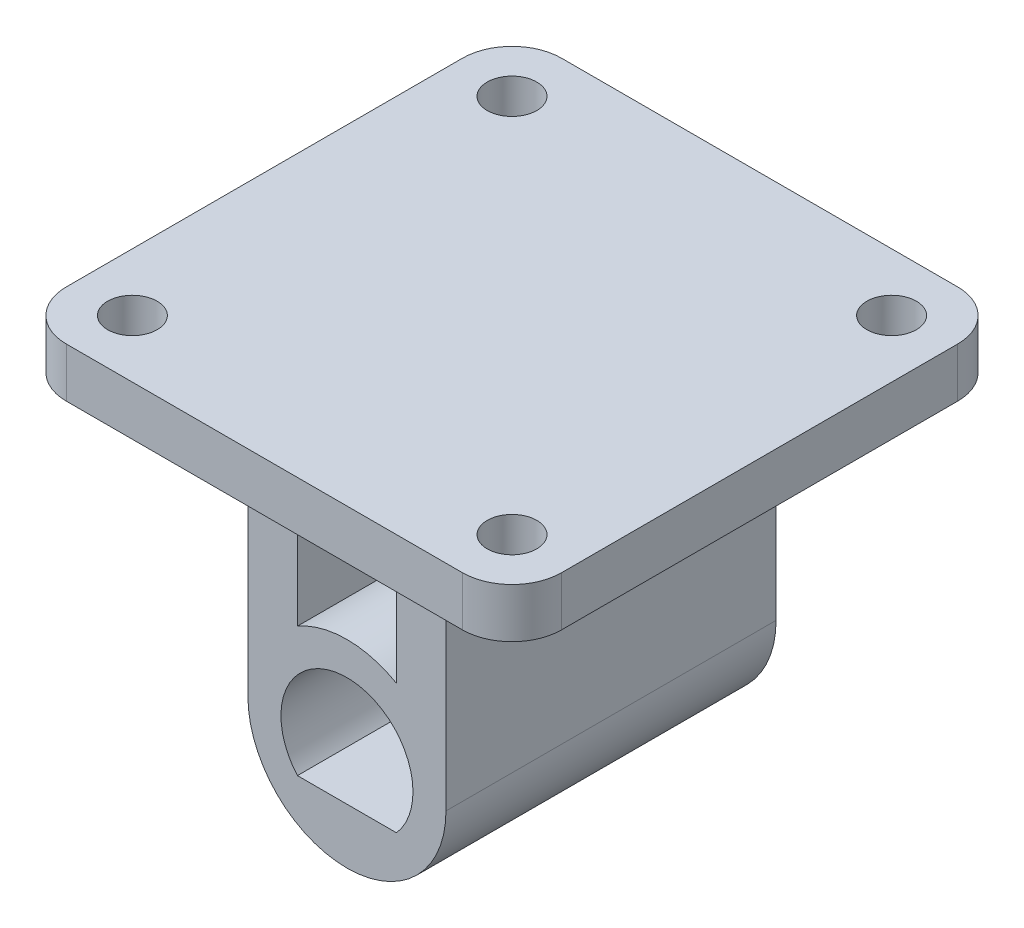
from build123d import *
from build123d.topology import SkipClean

# Parameters (mm, degrees)
CROQUIS1_W              = 30
CROQUIS1_H              = 30
SALIENTE_EXTRUIR1_DEPTH = 3
SALIENTE_EXTRUIR2_DEPTH = 20
CROQUIS4_R              = 1.5
CORTAR_EXTRUIR1_DEPTH   = 33.031234756
REDONDEO2_R             = 3
REDONDEO4_R             = 2
REDONDEO5_START         = -6
REDONDEO5_DEPTH         = 3
REDONDEO5_START_2       = 3
REDONDEO5_2_DEPTH       = 3
REDONDEO5_START_3       = -13.0000001
REDONDEO5_3_DEPTH       = 26.0000001
REDONDEO5_START_4       = -10
REDONDEO5_4_DEPTH       = 20


with BuildPart() as part:
    # Croquis1 → Saliente-Extruir1 (new body)
    with BuildSketch(Plane(origin=(0, 0, 0), x_dir=(1, 0, 0), z_dir=(0, 1, 0))):
        Rectangle(CROQUIS1_W, CROQUIS1_H)
    extrude(amount=SALIENTE_EXTRUIR1_DEPTH)

    # Croquis3 → Saliente-Extruir2 (add)
    with BuildSketch(Plane.XY.offset(10)):
        with BuildLine():
            Line((-3, 0), (-3, -9.803847577))
            ThreePointArc((-3, -9.803847577), (0, -9), (3, -9.803847577))
            Line((3, -9.803847577), (3, 0))
            Line((3, 0), (6, 0))
            Line((6, 0), (6, -15))
            ThreePointArc((6, -15), (0, -21), (-6, -15))
            Line((-6, -15), (-6, 0))
            Line((-6, 0), (-3, 0))
        make_face()
        with BuildLine():
            Line((-3, -17.645751311), (3, -17.645751311))
            ThreePointArc((3, -17.645751311), (0, -11), (-3, -17.645751311))
        make_face(mode=Mode.SUBTRACT)
    extrude(amount=-SALIENTE_EXTRUIR2_DEPTH)

    # Croquis4 → Cortar-Extruir1 (cut, through all)
    with BuildSketch(Plane(origin=(0, 3, 0), x_dir=(1, 0, 0), z_dir=(0, 1, 0))):
        with Locations(Location((-11.5, 11.5, 0), (0, 0, 270))):
            Circle(CROQUIS4_R)
        with Locations(Location((11.5, 11.5, 0), (0, 0, 270))):
            Circle(CROQUIS4_R)
        with Locations(Location((11.5, -11.5, 0), (0, 0, 270))):
            Circle(CROQUIS4_R)
        with Locations(Location((-11.5, -11.5, 0), (0, 0, 270))):
            Circle(CROQUIS4_R)
    extrude(amount=-CORTAR_EXTRUIR1_DEPTH, mode=Mode.SUBTRACT)

    # Redondeo2
    redondeo2_edges = [part.edges().sort_by_distance(p)[0] for p in [
        (-15, 1.5, -15),
        (15, 1.5, -15),
        (15, 1.5, 15),
        (-15, 1.5, 15),
    ]]
    fillet(redondeo2_edges, radius=REDONDEO2_R)

    # Redondeo4
    redondeo4_edges = [part.edges().sort_by_distance(p)[0] for p in [
        (-3, 0, 0),
        (3, 0, 0),
    ]]
    fillet(redondeo4_edges, radius=REDONDEO4_R)

    # Redondeo5: read off the stored shape, not the designer's step
    # Redondeo5 outline → Redondeo5 (add)
    with BuildSketch(Plane.YZ.offset(REDONDEO5_START)):
        with BuildLine():
            Line((0, -13), (0, -10))
            Line((0, -10), (-3, -10))
            ThreePointArc((-3, -10), (-0.878679656, -10.878679656), (0, -13))
        make_face()
        with BuildLine():
            ThreePointArc((0, 13), (-0.878679656, 10.878679656), (-3, 10))
            Line((-3, 10), (0, 10))
            Line((0, 10), (0, 13))
        make_face()
    extrude(amount=REDONDEO5_DEPTH)

    # Redondeo5 2 outline → Redondeo5 2 (add)
    with BuildSketch(Plane.YZ.offset(REDONDEO5_START_2)):
        with BuildLine():
            Line((0, -13), (0, -10))
            Line((0, -10), (-3, -10))
            ThreePointArc((-3, -10), (-0.878679656, -10.878679656), (0, -13))
        make_face()
        with BuildLine():
            ThreePointArc((0, 13), (-0.878679656, 10.878679656), (-3, 10))
            Line((-3, 10), (0, 10))
            Line((0, 10), (0, 13))
        make_face()
    extrude(amount=REDONDEO5_2_DEPTH)

    # Redondeo5 3 outline → Redondeo5 3 (add)
    with SkipClean():  # the faces are left unmerged after this step: merging them gives an invalid solid
        with BuildSketch(Plane.XY.offset(REDONDEO5_START_3)):
            with BuildLine():
                Line((-3, 0), (-3, -2))
                ThreePointArc((-3, -2), (-2.414213562, -0.585786438), (-1, 0))
                Line((-1, 0), (-3, 0))
            make_face()
            with BuildLine():
                Line((-6, -3), (-6, 0))
                Line((-6, 0), (-9, 0))
                ThreePointArc((-9, 0), (-6.878679656, -0.878679656), (-6, -3))
            make_face()
            with BuildLine():
                Line((9, 0), (6, 0))
                Line((6, 0), (6, -3))
                ThreePointArc((6, -3), (6.878679656, -0.878679656), (9, 0))
            make_face()
            with BuildLine():
                Line((3, 0), (1, 0))
                ThreePointArc((1, 0), (2.414213562, -0.585786438), (3, -2))
                Line((3, -2), (3, 0))
            make_face()
        extrude(amount=REDONDEO5_3_DEPTH)

    # Redondeo5 4 outline → Redondeo5 4 (cut)
    with SkipClean():  # the faces are left unmerged after this step: merging them gives an invalid solid
        with BuildSketch(Plane.YZ.offset(REDONDEO5_START_4)):
            with BuildLine():
                ThreePointArc((0, -13.00000005), (-0.878679638, -10.878679674), (-3, -10))
                Line((-3, -10), (-3, -13.0000001))
                Line((-3, -13.0000001), (0, -13.00000005))
            make_face()
            with BuildLine():
                Line((0, 13), (-3, 13))
                Line((-3, 13), (-3, 10))
                ThreePointArc((-3, 10), (-0.878679656, 10.878679656), (0, 13))
            make_face()
        extrude(amount=REDONDEO5_4_DEPTH, mode=Mode.SUBTRACT)


solid = part.part
